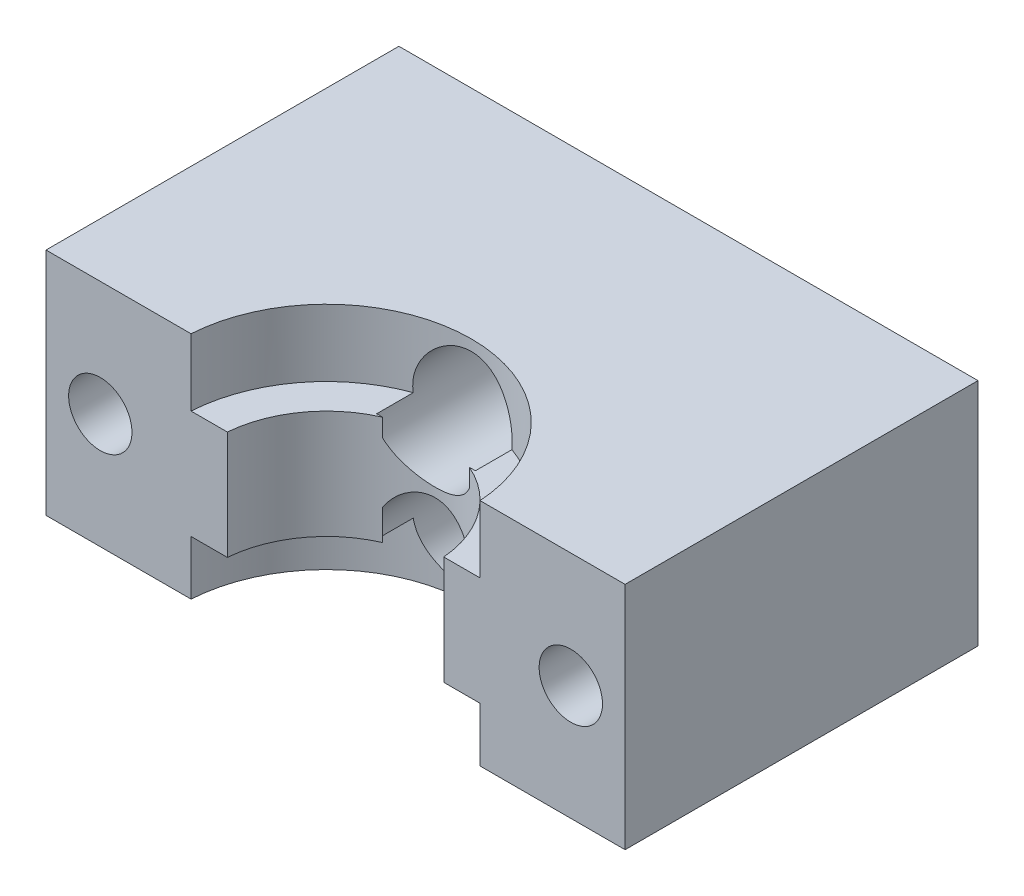
from build123d import *

# Parameters (mm, degrees)
SKETCH2_W           = 32
SKETCH2_H           = 12.7
SKETCH2_R           = 1.75
BOSS_EXTRUDE1_DEPTH = 19.5
SKETCH3_R           = 1.75
CUT_EXTRUDE1_DEPTH  = 27.011007285
CUT_EXTRUDE2_DEPTH  = 4
SKETCH5_R           = 8
CUT_EXTRUDE3_DEPTH  = 3.7
SKETCH9_R           = 6
CUT_EXTRUDE5_DEPTH  = 6
SKETCH10_R          = 8
CUT_EXTRUDE6_DEPTH  = 28.02480353
SKETCH6_R           = 2.75
CUT_EXTRUDE4_DEPTH  = 7.5


with BuildPart() as part:
    # Sketch2 → Boss-Extrude1 (new body)
    with BuildSketch(Plane.XY):
        Rectangle(SKETCH2_W, SKETCH2_H)
        with Locations((0, 3)):
            Circle(SKETCH2_R, mode=Mode.SUBTRACT)
        with Locations((0, -3)):
            Circle(SKETCH2_R, mode=Mode.SUBTRACT)
    extrude(amount=BOSS_EXTRUDE1_DEPTH)

    # Sketch3 → Cut-Extrude1 (cut, through all)
    with BuildSketch(Plane.XY.offset(19.5)):
        with Locations((-13, 0)):
            Circle(SKETCH3_R)
        with Locations((13, 0)):
            Circle(SKETCH3_R)
    extrude(amount=-CUT_EXTRUDE1_DEPTH, mode=Mode.SUBTRACT)

    # Sketch4 → Cut-Extrude2 (cut)
    with BuildSketch(Plane(origin=(0, 0, 0), x_dir=(-1, 0, 0), z_dir=(0, 0, -1))):
        Polygon((-10.25, -1.58771324), (-10.25, 1.58771324), (-13, 3.175426481), (-15.75, 1.58771324), (-15.75, -1.58771324), (-13, -3.175426481), align=None)
        Polygon((13, -3.175426481), (15.75, -1.58771324), (15.75, 1.58771324), (13, 3.175426481), (10.25, 1.58771324), (10.25, -1.58771324), align=None)
    extrude(amount=-CUT_EXTRUDE2_DEPTH, mode=Mode.SUBTRACT)

    # Sketch5 → Cut-Extrude3 (cut)
    with BuildSketch(Plane(origin=(0, 6.35, 0), x_dir=(1, 0, 0), z_dir=(0, 1, 0))):
        with Locations((0, -20)):
            Circle(SKETCH5_R)
    extrude(amount=-CUT_EXTRUDE3_DEPTH, mode=Mode.SUBTRACT)

    # Sketch9 → Cut-Extrude5 (cut)
    with BuildSketch(Plane(origin=(0, 2.65, 0), x_dir=(1, 0, 0), z_dir=(0, 1, 0))):
        with Locations((0, -20)):
            Circle(SKETCH9_R)
    extrude(amount=-CUT_EXTRUDE5_DEPTH, mode=Mode.SUBTRACT)

    # Sketch10 → Cut-Extrude6 (cut, through all)
    with BuildSketch(Plane(origin=(0, -3.35, 0), x_dir=(1, 0, 0), z_dir=(0, 1, 0))):
        with Locations((0, -20)):
            Circle(SKETCH10_R)
    extrude(amount=-CUT_EXTRUDE6_DEPTH, mode=Mode.SUBTRACT)

    # Sketch6 → Cut-Extrude4 (cut)
    with BuildSketch(Plane.XY.offset(14.5)):
        with Locations((0, 3)):
            Circle(SKETCH6_R)
        with Locations((0, -3)):
            Circle(SKETCH6_R)
    extrude(amount=-CUT_EXTRUDE4_DEPTH, mode=Mode.SUBTRACT)


solid = part.part
